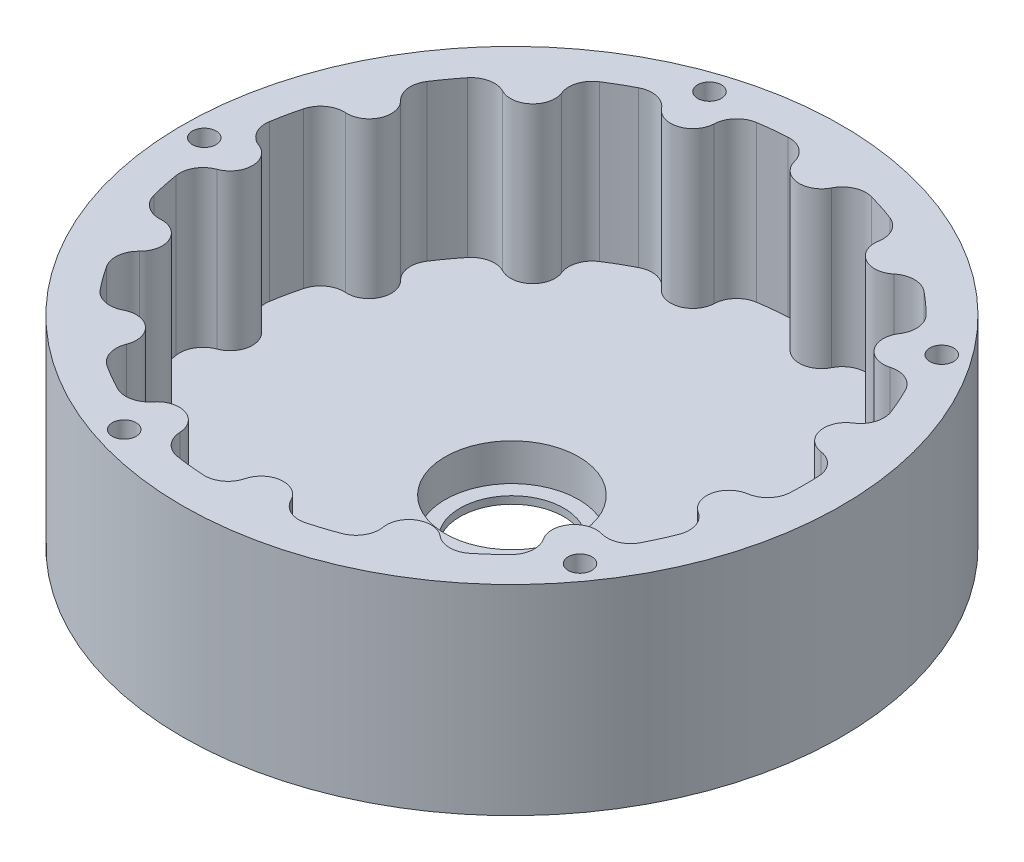
from build123d import *

# Parameters (mm, degrees)
SKETCH1_R            = 44.45
BOSS_EXTRUDE1_DEPTH  = 27
SKETCH1_3_R          = 44.45
BOSS_EXTRUDE2_DEPTH  = 6
SKETCH2_R            = 7
CUT_EXTRUDE1_DEPTH   = 69.414947197
CUT_EXTRUDE2_START   = 1
SKETCH2_3_R          = 9
SKETCH2_3_R_2        = 7
CUT_EXTRUDE2_DEPTH   = 68.414947197
M3_CLEARANCE_HOLE1_D = 3.2
CIRPATTERN1_COUNT    = 5


with BuildPart() as part:
    # Sketch1 → Boss-Extrude1 (new body)
    with BuildSketch(Plane(origin=(0, 0, 0), x_dir=(1, 0, 0), z_dir=(0, 1, 0))):
        Circle(SKETCH1_R)
        with BuildLine():
            ThreePointArc((-38.994571123, -6.298684221), (-38.602185265, -4.191732911), (-36.960419774, -2.814120281))
            ThreePointArc((-36.960419774, -2.814120281), (-35, 0), (-36.960419774, 2.814120281))
            ThreePointArc((-36.960419774, 2.814120281), (-38.602185265, 4.191732911), (-38.994571123, 6.298684221))
            ThreePointArc((-38.994571123, 6.298684221), (-38.827494163, 7.257802493), (-38.636830229, 8.212511787))
            ThreePointArc((-38.636830229, 8.212511787), (-38.422695146, 9.162232135), (-38.185218998, 10.106386598))
            ThreePointArc((-38.185218998, 10.106386598), (-36.969782377, 11.87158469), (-34.909629433, 12.462330266))
            ThreePointArc((-34.909629433, 12.462330266), (-31.974091017, 14.235782508), (-32.620417761, 17.603983865))
            ThreePointArc((-32.620417761, 17.603983865), (-33.559919631, 19.53026181), (-33.061407647, 21.614655316))
            ThreePointArc((-33.061407647, 21.614655316), (-32.518666702, 22.422897135), (-31.956171278, 23.217517466))
            ThreePointArc((-31.956171278, 23.217517466), (-31.37426308, 23.99803359), (-30.773295606, 24.76397136))
            ThreePointArc((-30.773295606, 24.76397136), (-28.944968255, 25.882197447), (-26.82264702, 25.583930693))
            ThreePointArc((-26.82264702, 25.583930693), (-23.419571223, 26.010068892), (-22.64004917, 29.349958712))
            ThreePointArc((-22.64004917, 29.349958712), (-22.714839011, 31.491831016), (-21.411626434, 33.193256144))
            ThreePointArc((-21.411626434, 33.193256144), (-20.587066345, 33.710869157), (-19.75, 34.208003449))
            ThreePointArc((-19.75, 34.208003449), (-18.900935901, 34.684357023), (-18.040389838, 35.139640501))
            ThreePointArc((-18.040389838, 35.139640501), (-15.915306166, 35.417543134), (-14.09778526, 34.28183708))
            ThreePointArc((-14.09778526, 34.28183708), (-10.815594803, 33.28697807), (-8.745010399, 36.021059062))
            ThreePointArc((-8.745010399, 36.021059062), (-7.942156368, 38.008176545), (-6.059580493, 39.032441433))
            ThreePointArc((-6.059580493, 39.032441433), (-5.09577519, 39.169925647), (-4.128874299, 39.283614867))
            ThreePointArc((-4.128874299, 39.283614867), (-3.159465195, 39.373440029), (-2.188136774, 39.439346565))
            ThreePointArc((-2.188136774, 39.439346565), (-0.133743055, 38.828873854), (1.064711645, 37.052102396))
            ThreePointArc((1.064711645, 37.052102396), (3.658496214, 34.808266338), (6.662120116, 36.463791059))
            ThreePointArc((6.662120116, 36.463791059), (8.203797264, 37.952563055), (10.340221965, 38.122563))
            ThreePointArc((10.340221965, 38.122563), (11.276621789, 37.856146146), (12.206171278, 37.566732394))
            ThreePointArc((12.206171278, 37.566732394), (13.128305747, 37.254497557), (14.042465016, 36.919631313))
            ThreePointArc((14.042465016, 36.919631313), (15.670945446, 35.526339536), (16.043110235, 33.415722599))
            ThreePointArc((16.043110235, 33.415722599), (17.5, 30.310889132), (20.917309539, 30.601602319))
            ThreePointArc((20.917309539, 30.601602319), (22.931239819, 31.334606626), (24.952106107, 30.620947092))
            ThreePointArc((24.952106107, 30.620947092), (25.699188416, 29.996695064), (26.430658951, 29.354220606))
            ThreePointArc((26.430658951, 29.354220606), (27.146073357, 28.693914011), (27.844997033, 28.016176403))
            ThreePointArc((27.844997033, 28.016176403), (28.765985113, 26.080978366), (28.247509317, 24.001460793))
            ThreePointArc((28.247509317, 24.001460793), (28.315594803, 20.57248383), (31.555706116, 19.448118531))
            ThreePointArc((31.555706116, 19.448118531), (33.693662686, 19.298612044), (35.249544421, 17.824691249))
            ThreePointArc((35.249544421, 17.824691249), (35.678131896, 16.950542893), (36.085045577, 16.066097401))
            ThreePointArc((36.085045577, 16.066097401), (36.47003827, 15.171892057), (36.8328761, 14.268470073))
            ThreePointArc((36.8328761, 14.268470073), (36.887124623, 12.125979097), (35.567657418, 10.437128369))
            ThreePointArc((35.567657418, 10.437128369), (34.235166026, 7.276909179), (36.73783443, 4.931878368))
            ThreePointArc((36.73783443, 4.931878368), (38.630145177, 3.925712118), (39.452016272, 1.946384357))
            ThreePointArc((39.452016272, 1.946384357), (39.488002246, 0.973487866), (39.5, 0))
            ThreePointArc((39.5, 0), (39.488002246, -0.973487866), (39.452016272, -1.946384357))
            ThreePointArc((39.452016272, -1.946384357), (38.630145177, -3.925712118), (36.73783443, -4.931878368))
            ThreePointArc((36.73783443, -4.931878368), (34.235166026, -7.276909179), (35.567657418, -10.437128369))
            ThreePointArc((35.567657418, -10.437128369), (36.887124623, -12.125979097), (36.8328761, -14.268470073))
            ThreePointArc((36.8328761, -14.268470073), (36.47003827, -15.171892057), (36.085045577, -16.066097401))
            ThreePointArc((36.085045577, -16.066097401), (35.678131896, -16.950542893), (35.249544421, -17.824691249))
            ThreePointArc((35.249544421, -17.824691249), (33.693662686, -19.298612044), (31.555706116, -19.448118531))
            ThreePointArc((31.555706116, -19.448118531), (28.315594803, -20.57248383), (28.247509317, -24.001460793))
            ThreePointArc((28.247509317, -24.001460793), (28.765985113, -26.080978366), (27.844997033, -28.016176403))
            ThreePointArc((27.844997033, -28.016176403), (27.146073357, -28.693914011), (26.430658951, -29.354220606))
            ThreePointArc((26.430658951, -29.354220606), (25.699188416, -29.996695064), (24.952106107, -30.620947092))
            ThreePointArc((24.952106107, -30.620947092), (22.931239819, -31.334606626), (20.917309539, -30.601602319))
            ThreePointArc((20.917309539, -30.601602319), (17.5, -30.310889132), (16.043110235, -33.415722599))
            ThreePointArc((16.043110235, -33.415722599), (15.670945446, -35.526339536), (14.042465016, -36.919631313))
            ThreePointArc((14.042465016, -36.919631313), (13.128305747, -37.254497557), (12.206171278, -37.566732394))
            ThreePointArc((12.206171278, -37.566732394), (11.276621789, -37.856146146), (10.340221965, -38.122563))
            ThreePointArc((10.340221965, -38.122563), (8.203797264, -37.952563055), (6.662120116, -36.463791059))
            ThreePointArc((6.662120116, -36.463791059), (3.658496214, -34.808266338), (1.064711645, -37.052102396))
            ThreePointArc((1.064711645, -37.052102396), (-0.133743055, -38.828873854), (-2.188136774, -39.439346565))
            ThreePointArc((-2.188136774, -39.439346565), (-3.159465195, -39.373440029), (-4.128874299, -39.283614867))
            ThreePointArc((-4.128874299, -39.283614867), (-5.09577519, -39.169925647), (-6.059580493, -39.032441433))
            ThreePointArc((-6.059580493, -39.032441433), (-7.942156368, -38.008176545), (-8.745010399, -36.021059062))
            ThreePointArc((-8.745010399, -36.021059062), (-10.815594803, -33.28697807), (-14.09778526, -34.28183708))
            ThreePointArc((-14.09778526, -34.28183708), (-15.915306166, -35.417543134), (-18.040389838, -35.139640501))
            ThreePointArc((-18.040389838, -35.139640501), (-18.900935901, -34.684357023), (-19.75, -34.208003449))
            ThreePointArc((-19.75, -34.208003449), (-20.587066345, -33.710869157), (-21.411626434, -33.193256144))
            ThreePointArc((-21.411626434, -33.193256144), (-22.714839011, -31.491831016), (-22.64004917, -29.349958712))
            ThreePointArc((-22.64004917, -29.349958712), (-23.419571223, -26.010068892), (-26.82264702, -25.583930693))
            ThreePointArc((-26.82264702, -25.583930693), (-28.944968255, -25.882197447), (-30.773295606, -24.76397136))
            ThreePointArc((-30.773295606, -24.76397136), (-31.37426308, -23.99803359), (-31.956171278, -23.217517466))
            ThreePointArc((-31.956171278, -23.217517466), (-32.518666702, -22.422897135), (-33.061407647, -21.614655316))
            ThreePointArc((-33.061407647, -21.614655316), (-33.559919631, -19.53026181), (-32.620417761, -17.603983865))
            ThreePointArc((-32.620417761, -17.603983865), (-31.974091017, -14.235782508), (-34.909629433, -12.462330266))
            ThreePointArc((-34.909629433, -12.462330266), (-36.969782377, -11.87158469), (-38.185218998, -10.106386598))
            ThreePointArc((-38.185218998, -10.106386598), (-38.422695146, -9.162232135), (-38.636830229, -8.212511787))
            ThreePointArc((-38.636830229, -8.212511787), (-38.827494163, -7.257802493), (-38.994571123, -6.298684221))
        make_face(mode=Mode.SUBTRACT)
    extrude(amount=BOSS_EXTRUDE1_DEPTH)

    # Sketch1<3> → Boss-Extrude2 (add)
    with BuildSketch(Plane(origin=(0, 0, 0), x_dir=(1, 0, 0), z_dir=(0, 1, 0))):
        Circle(SKETCH1_3_R)
    extrude(amount=BOSS_EXTRUDE2_DEPTH)

    # Sketch2 → Cut-Extrude1 (cut, through all)
    with BuildSketch(Plane(origin=(0, 0, 0), x_dir=(1, 0, 0), z_dir=(0, 1, 0))):
        Circle(SKETCH2_R)
    extrude(amount=CUT_EXTRUDE1_DEPTH, mode=Mode.SUBTRACT)

    # Sketch2<3> → Cut-Extrude2 (cut, through all)
    with BuildSketch(Plane(origin=(0, 0, 0), x_dir=(1, 0, 0), z_dir=(0, 1, 0)).offset(CUT_EXTRUDE2_START)):
        Circle(SKETCH2_3_R)
        Circle(SKETCH2_3_R_2, mode=Mode.SUBTRACT)
    extrude(amount=CUT_EXTRUDE2_DEPTH, mode=Mode.SUBTRACT)

    # M3 Clearance Hole1 (through all)
    with Locations(Plane(origin=(0, 27, 0), x_dir=(1, 0, 0), z_dir=(0, 1, 0))):
        with Locations((-41.5, 0)):
            m3_clearance_hole1 = Hole(M3_CLEARANCE_HOLE1_D / 2)

    # CirPattern1: M3 Clearance Hole1 ×5 about axis
    cirpattern1_axis = Axis((0, 27, 0), (0, -1, 0))
    for i in range(1, CIRPATTERN1_COUNT):
        add(m3_clearance_hole1.rotate(cirpattern1_axis, i * 360 / CIRPATTERN1_COUNT), mode=Mode.SUBTRACT)


solid = part.part
